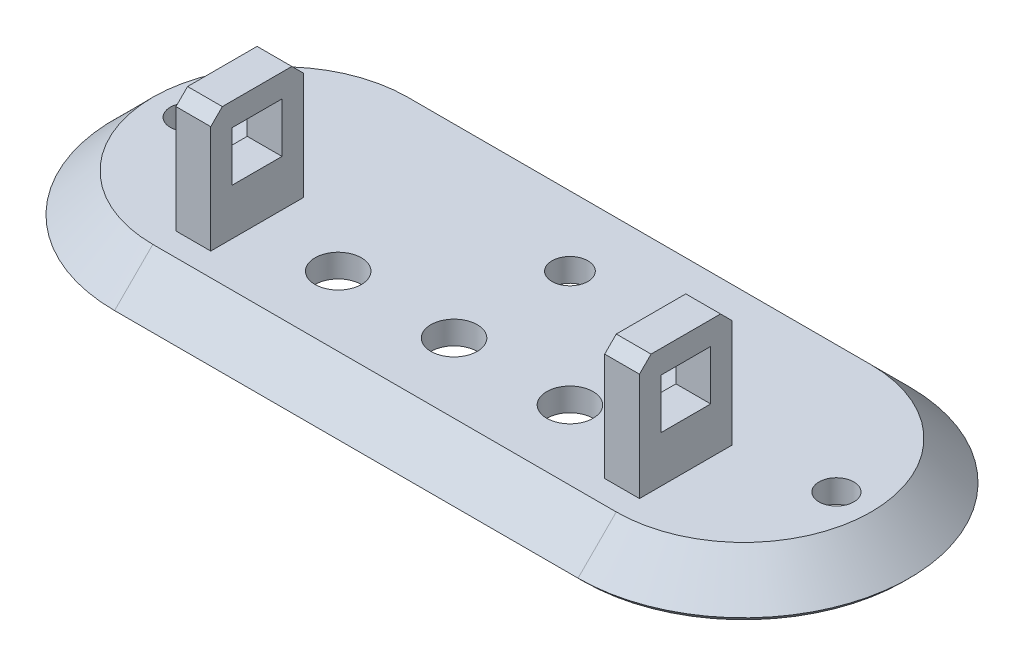
from build123d import *
from OCP.BRepFilletAPI import BRepFilletAPI_MakeChamfer

# Parameters (mm, degrees)
BOSS_EXTRU_1_DEPTH           = 3.8
BOSS_EXTRU_1_TAPER           = 45
COQUE2_DEPTH                 = 1.8
COQUE2_DRAFT                 = 45
CHANFREIN1_SIZE              = 1
CHANFREIN1_SIZE2             = 0.707106781
ENL_V_MAT_EXTRU_1_REACH      = 39.355
ESQUISSE2_R                  = 1.5
ENL_V_MAT_EXTRU_2_REACH      = 39.215
ESQUISSE3_R                  = 1.55
ESQUISSE3_R_2                = 2
ESQUISSE4_W                  = 4.3
ESQUISSE4_H                  = 4.3
BOSS_EXTRU_2_DEPTH           = 3
CHANFREIN2_SIZE              = 1
CHANFREIN2_OF_SYM_TRIE1_SIZE = 1


# Read off the part's stored shape, not the designer's step: Coque2
with BuildPart() as part:
    # Esquisse1 → Boss.-Extru.1 (new body)
    with BuildSketch(Plane(origin=(0, 0, 0), x_dir=(1, 0, 0), z_dir=(0, 1, 0))):
        with BuildLine():
            ThreePointArc((-20, 14.8), (-34.8, 0), (-20, -14.8))
            Line((-20, -14.8), (20, -14.8))
            ThreePointArc((20, -14.8), (34.8, 0), (20, 14.8))
            Line((20, 14.8), (-20, 14.8))
        make_face()
    extrude(amount=BOSS_EXTRU_1_DEPTH, taper=BOSS_EXTRU_1_TAPER)


with BuildPart() as coque2_tool:
    # Coque2 outline → Coque2 (with draft: the straight prism first)
    with BuildSketch(Plane(origin=(0, 1.8, 0), x_dir=(1, 0, 0), z_dir=(0, 1, 0))):
        with BuildLine():
            Line((-20, -10.171572875), (20, -10.171572875))
            ThreePointArc((20, -10.171572875), (30.171572875, 0), (20, 10.171572875))
            Line((20, 10.171572875), (-20, 10.171572875))
            ThreePointArc((-20, 10.171572875), (-30.171572875, 0), (-20, -10.171572875))
        make_face()
    extrude(amount=-COQUE2_DEPTH)
    # Coque2: the draft: its side faces are tilted about the plane it starts from
    coque2_sides = [coque2_tool.faces().sort_by_distance(p)[0] for p in [
        (0, 0.9, 10.171572875),
        (30.171572875, 0.9, 0),
        (0, 0.9, -10.171572875),
        (-30.171572875, 0.9, 0),
    ]]
    draft(coque2_sides, Plane(origin=(0, 1.8, 0), x_dir=(1, 0, 0), z_dir=(0, 1, 0)), COQUE2_DRAFT)


with BuildPart() as part_1:
    add(part.part)

    # Coque2: cut by coque2_tool
    add(coque2_tool.part, mode=Mode.SUBTRACT)

    # Chanfrein1: one chamfer whose edges measure the first distance from different faces: ONE call of the kernel's chamfer builder (chamfer() names one face for all edges)
    chanfrein1_edges_1 = [part_1.edges().sort_by_distance(p)[0] for p in [
        (0, 0, -14.8),
        (0, 0, 14.8),
        (-34.8, 0, 0),
    ]]
    chanfrein1_side_1 = [part_1.faces().sort_by_distance(p)[0] for p in [
        (0, 0, -14.043672029),
    ]]
    chanfrein1_edges_2 = [part_1.edges().sort_by_distance(p)[0] for p in [
        (34.8, 0, 0),
    ]]
    chanfrein1_side_2 = [part_1.faces().sort_by_distance(p)[0] for p in [
        (32.9, 1.9, 0),
    ]]
    chanfrein1 = BRepFilletAPI_MakeChamfer(part_1.part.solid().wrapped)
    for e in chanfrein1_edges_1:
        chanfrein1.Add(CHANFREIN1_SIZE, CHANFREIN1_SIZE2, e.wrapped, chanfrein1_side_1[0].wrapped)  # the first distance lies on this face
    for e in chanfrein1_edges_2:
        chanfrein1.Add(CHANFREIN1_SIZE, CHANFREIN1_SIZE2, e.wrapped, chanfrein1_side_2[0].wrapped)  # the first distance lies on this face
    add(Compound.cast(chanfrein1.Shape()), mode=Mode.REPLACE)

    # Esquisse2 → Enlèv. mat.-Extru.1 (cut, up to next)
    with BuildSketch(Plane(origin=(0, 3.8, 0), x_dir=(1, 0, 0), z_dir=(0, 1, 0)), mode=Mode.PRIVATE) as enl_v_mat_extru_1_sk1:
        with Locations(Location((-28, 0, 0), (0, 0, 270))):
            Circle(ESQUISSE2_R)
    enl_v_mat_extru_1_tool1 = extrude(enl_v_mat_extru_1_sk1.sketch, amount=-ENL_V_MAT_EXTRU_1_REACH, mode=Mode.PRIVATE) & part_1.part
    # Esquisse2 → Enlèv. mat.-Extru.1 (cut, up to next)
    with BuildSketch(Plane(origin=(0, 3.8, 0), x_dir=(1, 0, 0), z_dir=(0, 1, 0)), mode=Mode.PRIVATE) as enl_v_mat_extru_1_sk2:
        with Locations(Location((28, 0, 0), (0, 0, 270))):
            Circle(ESQUISSE2_R)
    enl_v_mat_extru_1_tool2 = extrude(enl_v_mat_extru_1_sk2.sketch, amount=-ENL_V_MAT_EXTRU_1_REACH, mode=Mode.PRIVATE) & part_1.part
    add(enl_v_mat_extru_1_tool1.solids().sort_by_distance((-28, 3.8, 0))[0], mode=Mode.SUBTRACT)
    add(enl_v_mat_extru_1_tool2.solids().sort_by_distance((28, 3.8, 0))[0], mode=Mode.SUBTRACT)

    # Esquisse3 → Enlèv. mat.-Extru.2 (cut, up to next)
    with BuildSketch(Plane.XZ.offset(-1.8), mode=Mode.PRIVATE) as enl_v_mat_extru_2_sk1:
        with Locations(Location((0, -5, 0), (0, 0, 270))):
            Circle(ESQUISSE3_R)
    enl_v_mat_extru_2_tool1 = extrude(enl_v_mat_extru_2_sk1.sketch, amount=-ENL_V_MAT_EXTRU_2_REACH, mode=Mode.PRIVATE) & part_1.part
    # Esquisse3 → Enlèv. mat.-Extru.2 (cut, up to next)
    with BuildSketch(Plane.XZ.offset(-1.8), mode=Mode.PRIVATE) as enl_v_mat_extru_2_sk2:
        with Locations(Location((10, 5, 0), (0, 0, 270))):
            Circle(ESQUISSE3_R_2)
    enl_v_mat_extru_2_tool2 = extrude(enl_v_mat_extru_2_sk2.sketch, amount=-ENL_V_MAT_EXTRU_2_REACH, mode=Mode.PRIVATE) & part_1.part
    # Esquisse3 → Enlèv. mat.-Extru.2 (cut, up to next)
    with BuildSketch(Plane.XZ.offset(-1.8), mode=Mode.PRIVATE) as enl_v_mat_extru_2_sk3:
        with Locations(Location((0, 5, 0), (0, 0, 270))):
            Circle(ESQUISSE3_R_2)
    enl_v_mat_extru_2_tool3 = extrude(enl_v_mat_extru_2_sk3.sketch, amount=-ENL_V_MAT_EXTRU_2_REACH, mode=Mode.PRIVATE) & part_1.part
    # Esquisse3 → Enlèv. mat.-Extru.2 (cut, up to next)
    with BuildSketch(Plane.XZ.offset(-1.8), mode=Mode.PRIVATE) as enl_v_mat_extru_2_sk4:
        with Locations(Location((-10, 5, 0), (0, 0, 270))):
            Circle(ESQUISSE3_R_2)
    enl_v_mat_extru_2_tool4 = extrude(enl_v_mat_extru_2_sk4.sketch, amount=-ENL_V_MAT_EXTRU_2_REACH, mode=Mode.PRIVATE) & part_1.part
    add(enl_v_mat_extru_2_tool1.solids().sort_by_distance((0, 1.8, -5))[0], mode=Mode.SUBTRACT)
    add(enl_v_mat_extru_2_tool2.solids().sort_by_distance((10, 1.8, 5))[0], mode=Mode.SUBTRACT)
    add(enl_v_mat_extru_2_tool3.solids().sort_by_distance((0, 1.8, 5))[0], mode=Mode.SUBTRACT)
    add(enl_v_mat_extru_2_tool4.solids().sort_by_distance((-10, 1.8, 5))[0], mode=Mode.SUBTRACT)

    # Esquisse4 → Boss.-Extru.2 (add)
    with BuildSketch(Plane.ZY.offset(-20)):
        Polygon((9, 3.8), (1, 3.8), (1, 14.1), (5, 14.1), (9, 14.1), align=None)
        with Locations((5, 9.95)):
            Rectangle(ESQUISSE4_W, ESQUISSE4_H, mode=Mode.SUBTRACT)
    boss_extru_2 = extrude(amount=BOSS_EXTRU_2_DEPTH)

    # Chanfrein2
    chanfrein2_edges = [part_1.edges().sort_by_distance(p)[0] for p in [
        (18.5, 14.1, 9),
        (18.5, 14.1, 1),
    ]]
    chamfer(chanfrein2_edges, length=CHANFREIN2_SIZE)

    # Symétrie1: Boss.-Extru.2 across plane
    add(boss_extru_2.mirror(Plane(origin=(0, 0, 0), x_dir=(0, 0, 1), z_dir=(1, 0, 0))))

    # Chanfrein2 of Symétrie1
    chanfrein2_of_sym_trie1_edges = [part_1.edges().sort_by_distance(p)[0] for p in [
        (-18.5, 14.1, 9),
        (-18.5, 14.1, 1),
    ]]
    chamfer(chanfrein2_of_sym_trie1_edges, length=CHANFREIN2_OF_SYM_TRIE1_SIZE)


solid = part_1.part
